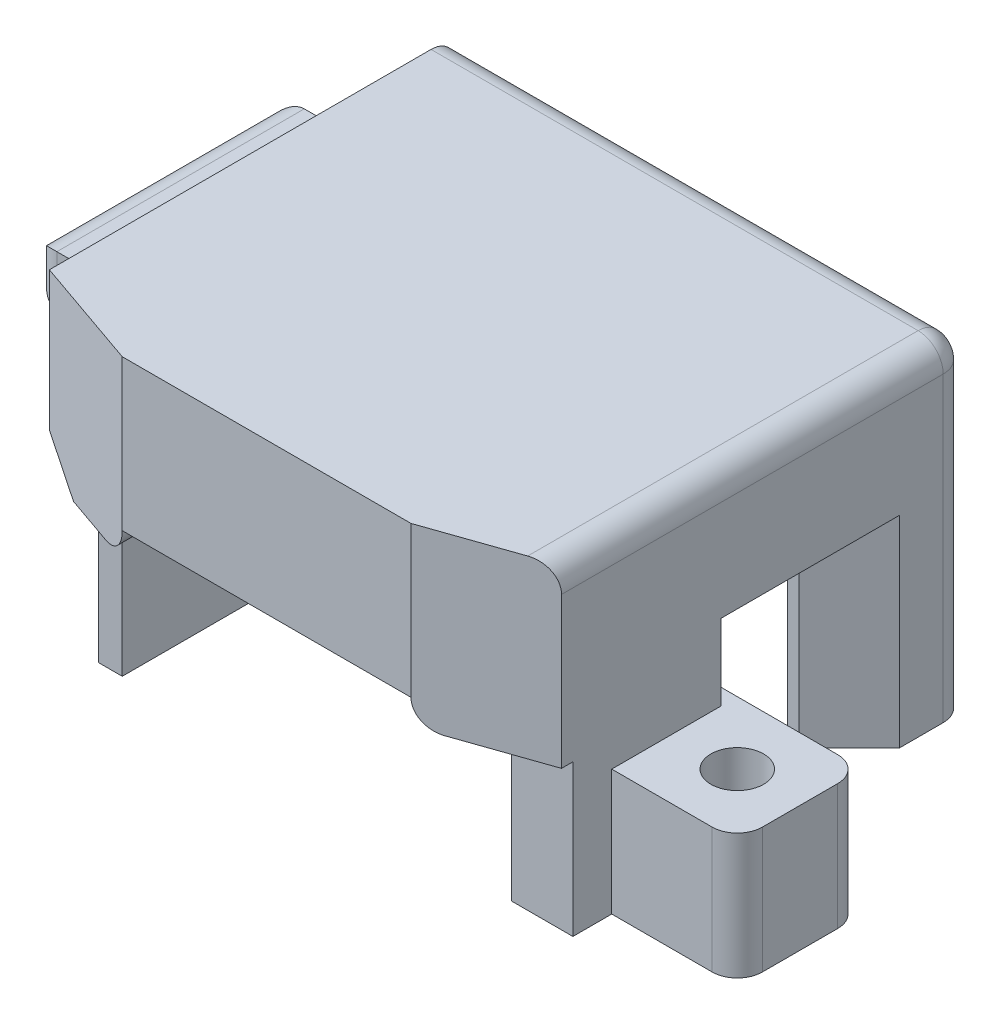
from build123d import *

# Parameters (mm, degrees)
SKETCH1_W            = 45.72
SKETCH1_H            = 43.18
BOSS_EXTRUDE1_DEPTH  = 31.75
SKETCH2_W            = 39.37
SKETCH2_H            = 36.83
CUT_EXTRUDE3_DEPTH   = 25.4
SKETCH3_W            = 45.72
SKETCH3_H            = 31.75
CUT_EXTRUDE5_DEPTH   = 3.175
BOSS_EXTRUDE4_DEPTH  = 38.1
SKETCH7_W            = 39.37
SKETCH7_H            = 25.151618727
BOSS_EXTRUDE5_DEPTH  = 36.83
SKETCH8_W            = 40.005
SKETCH8_H            = 69.85
BOSS_EXTRUDE6_DEPTH  = 6.35
SKETCH9_W            = 40.005
SKETCH9_H            = 69.85
BOSS_EXTRUDE7_DEPTH  = 6.35
CUT_EXTRUDE8_DEPTH   = 61.468
SKETCH13_W           = 58.42
SKETCH13_H           = 26.3525
BOSS_EXTRUDE8_DEPTH  = 16.002
CUT_EXTRUDE9_DEPTH   = 16.51
SKETCH15_W           = 37.994827887
SKETCH15_H           = 16.002
BOSS_EXTRUDE9_DEPTH  = 5.08
SKETCH16_W           = 58.42
SKETCH16_H           = 40.005
CUT_EXTRUDE11_DEPTH  = 38.1
SKETCH17_W           = 9.525
SKETCH17_H           = 12.7
BOSS_EXTRUDE10_DEPTH = 13.97
SKETCH18_W           = 9.525
SKETCH18_H           = 12.7
BOSS_EXTRUDE11_DEPTH = 13.97
SKETCH19_W           = 39.37
SKETCH19_H           = 3.81
BOSS_EXTRUDE14_DEPTH = 5.08
CUT_EXTRUDE12_DEPTH  = 3.81
BOSS_EXTRUDE22_DEPTH = 3.809999
BOSS_EXTRUDE23_START = -1e-06
BOSS_EXTRUDE23_DEPTH = 21.34162
BOSS_EXTRUDE24_DEPTH = 6.598381
SKETCH40_W           = 39.37
SKETCH40_H           = 36.83
BOSS_EXTRUDE25_DEPTH = 4.826
SKETCH42_W           = 37.994827887
SKETCH42_H           = 16.002
BOSS_EXTRUDE26_DEPTH = 3.302
SKETCH43_W           = 39.37
SKETCH43_H           = 13.582012484
CUT_EXTRUDE13_DEPTH  = 6.35
SKETCH45_W           = 39.37
SKETCH45_H           = 13.582012484
BOSS_EXTRUDE27_DEPTH = 19.05
CUT_EXTRUDE15_DEPTH  = 3.302
CUT_EXTRUDE16_DEPTH  = 3.302
SKETCH48_W           = 3.302
SKETCH48_H           = 36.576
CUT_EXTRUDE17_DEPTH  = 3.302
SKETCH49_W           = 3.302
SKETCH49_H           = 36.576
CUT_EXTRUDE18_DEPTH  = 3.302
SKETCH50_W           = 63.22676162
SKETCH50_H           = 45.986337428
CUT_EXTRUDE19_DEPTH  = 16.002
SKETCH51_W           = 54.973573954
SKETCH51_H           = 46.584394505
CUT_EXTRUDE20_DEPTH  = 18.796
SKETCH52_W           = 6.223
SKETCH52_H           = 20.055366997
SKETCH52_H_2         = 8.89
BOSS_EXTRUDE28_DEPTH = 15.3035
SKETCH53_W           = 12.7
SKETCH53_H           = 3.81
BOSS_EXTRUDE29_DEPTH = 10.16
SKETCH54_W           = 12.7
SKETCH54_H           = 3.81
BOSS_EXTRUDE30_DEPTH = 10.16
CUT_EXTRUDE21_DEPTH  = 12.7
CUT_EXTRUDE22_DEPTH  = 12.7
SKETCH60_R           = 2.667
CUT_EXTRUDE25_DEPTH  = 10.16
SKETCH62_W           = 29.21
SKETCH62_H           = 5.08
CUT_EXTRUDE27_DEPTH  = 2.54
SKETCH63_W           = 25.4
SKETCH63_H           = 38.1
CUT_EXTRUDE28_DEPTH  = 3.175
SKETCH64_W           = 12.102561389
SKETCH64_H           = 15.659817378
SKETCH64_W_2         = 11.935696887
SKETCH64_H_2         = 14.711913551
CUT_EXTRUDE29_DEPTH  = 3.81
SKETCH65_W           = 12.7
SKETCH65_H           = 12.7
SKETCH65_R           = 2.667
BOSS_EXTRUDE31_DEPTH = 12.7
SKETCH66_W           = 6.35
SKETCH66_H           = 13.97
CUT_EXTRUDE30_DEPTH  = 85.737175224
SKETCH68_W           = 3.81
SKETCH68_H           = 13.97
CUT_EXTRUDE31_DEPTH  = 29.718
CHAMFER1_SIZE        = 5.08
BOSS_EXTRUDE32_DEPTH = 12.7
FILLET8_R            = 2.54
FILLET9_R            = 2.54
FILLET13_R           = 2.54
FILLET14_R           = 2.54
FILLET1_R            = 2.54
FILLET2_R            = 2.54
FILLET17_R           = 2.54
CHAMFER2_SIZE        = 1.27


with BuildPart() as part:
    # Sketch1 → Boss-Extrude1 (new body)
    with BuildSketch(Plane(origin=(0, 0, 0), x_dir=(1, 0, 0), z_dir=(0, 1, 0))):
        Rectangle(SKETCH1_W, SKETCH1_H)
    extrude(amount=BOSS_EXTRUDE1_DEPTH)

    # Sketch2 → Cut-Extrude3 (cut)
    with BuildSketch(Plane(origin=(0, 31.75, 0), x_dir=(1, 0, 0), z_dir=(0, 1, 0))):
        Rectangle(SKETCH2_W, SKETCH2_H)
    extrude(amount=-CUT_EXTRUDE3_DEPTH, mode=Mode.SUBTRACT)

    # Sketch3 → Cut-Extrude5 (cut)
    with BuildSketch(Plane.XY.offset(21.59)):
        with Locations((0, 15.875)):
            Rectangle(SKETCH3_W, SKETCH3_H)
    extrude(amount=-CUT_EXTRUDE5_DEPTH, mode=Mode.SUBTRACT)

    # Sketch6 → Boss-Extrude4 (add)
    with BuildSketch(Plane(origin=(0, 31.75, 0), x_dir=(1, 0, 0), z_dir=(0, 1, 0))):
        Polygon((-22.86, -18.415), (-19.685, -18.415), (-19.685, 18.415), (19.685, 18.415), (19.685, -18.415), (22.86, -18.415), (22.86, 21.59), (-22.86, 21.59), align=None)
    extrude(amount=BOSS_EXTRUDE4_DEPTH)

    # Sketch7 → Boss-Extrude5 (add)
    with BuildSketch(Plane.XY.offset(-18.415)):
        with Locations((0, 57.274190637)):
            Rectangle(SKETCH7_W, SKETCH7_H)
    extrude(amount=BOSS_EXTRUDE5_DEPTH)

    # Sketch8 → Boss-Extrude6 (add)
    with BuildSketch(Plane(origin=(22.86, 0, 0), x_dir=(0, 0, -1), z_dir=(1, 0, 0))):
        with Locations((1.5875, 34.925)):
            Rectangle(SKETCH8_W, SKETCH8_H)
    extrude(amount=BOSS_EXTRUDE6_DEPTH)

    # Sketch9 → Boss-Extrude7 (add)
    with BuildSketch(Plane.ZY.offset(22.86)):
        with Locations((-1.5875, 34.925)):
            Rectangle(SKETCH9_W, SKETCH9_H)
    extrude(amount=BOSS_EXTRUDE7_DEPTH)

    # Sketch11 → Cut-Extrude8 (cut)
    with BuildSketch(Plane.ZY.offset(29.21)):
        Polygon((4.7625, 58.280393757), (-1.5875, 58.280393757), (-7.9375, 58.280393757), (-7.9375, 44.310393757), (4.7625, 44.310393757), align=None)
    extrude(amount=-CUT_EXTRUDE8_DEPTH, mode=Mode.SUBTRACT)

    # Sketch13 → Boss-Extrude8 (add)
    with BuildSketch(Plane(origin=(0, 69.85, 0), x_dir=(1, 0, 0), z_dir=(0, 1, 0))):
        with Locations((0, 8.41375)):
            Rectangle(SKETCH13_W, SKETCH13_H)
    extrude(amount=BOSS_EXTRUDE8_DEPTH)

    # Sketch14 → Cut-Extrude9 (cut)
    with BuildSketch(Plane(origin=(0, 0, -21.59), x_dir=(-1, 0, 0), z_dir=(0, 0, -1))):
        Polygon((10.16, 85.852), (0, 85.852), (-10.16, 85.852), (-10.16, 73.175571961), (-3.81, 73.175571961), (10.16, 73.175571961), align=None)
    extrude(amount=-CUT_EXTRUDE9_DEPTH, mode=Mode.SUBTRACT)

    # Sketch15 → Boss-Extrude9 (add)
    with BuildSketch(Plane.XY.offset(4.7625)):
        with Locations((0.097658191, 77.851)):
            Rectangle(SKETCH15_W, SKETCH15_H)
    extrude(amount=BOSS_EXTRUDE9_DEPTH)

    # Sketch16 → Cut-Extrude11 (cut)
    with BuildSketch(Plane.XZ):
        with Locations((0, -1.5875)):
            Rectangle(SKETCH16_W, SKETCH16_H)
    extrude(amount=-CUT_EXTRUDE11_DEPTH, mode=Mode.SUBTRACT)

    # Sketch17 → Boss-Extrude10 (add)
    with BuildSketch(Plane(origin=(0, 44.310393757, 0), x_dir=(1, 0, 0), z_dir=(0, 1, 0))):
        with Locations((24.4475, 1.5875)):
            Rectangle(SKETCH17_W, SKETCH17_H)
    extrude(amount=BOSS_EXTRUDE10_DEPTH)

    # Sketch18 → Boss-Extrude11 (add)
    with BuildSketch(Plane(origin=(0, 44.310393757, 0), x_dir=(1, 0, 0), z_dir=(0, 1, 0))):
        with Locations((-24.4475, 1.5875)):
            Rectangle(SKETCH18_W, SKETCH18_H)
    extrude(amount=BOSS_EXTRUDE11_DEPTH)

    # Sketch19 → Boss-Extrude14 (add)
    with BuildSketch(Plane.XY.offset(18.415)):
        with Locations((0, 46.603381273)):
            Rectangle(SKETCH19_W, SKETCH19_H)
    extrude(amount=BOSS_EXTRUDE14_DEPTH)

    # Sketch21 → Cut-Extrude12 (cut)
    with BuildSketch(Plane.XZ.offset(-44.698381273)):
        Polygon((-19.685, 18.415), (-19.685, 23.495), (-14.605, 23.495), align=None)
        Polygon((19.685, 18.415), (19.685, 23.495), (14.605, 23.495), align=None)
    extrude(amount=-CUT_EXTRUDE12_DEPTH, mode=Mode.SUBTRACT)

    # Sketch36 → Boss-Extrude22 (add)
    with BuildSketch(Plane.XZ.offset(-44.698381273)):
        Polygon((-14.605, 23.495), (-29.21, 18.415), (-14.605, 18.415), align=None)
        Polygon((14.605, 23.495), (29.21, 18.415), (14.605, 18.415), align=None)
    extrude(amount=-BOSS_EXTRUDE22_DEPTH)

    # Sketch37 → Boss-Extrude23 (add)
    with BuildSketch(Plane(origin=(0, 48.508381273, 0), x_dir=(1, 0, 0), z_dir=(0, 1, 0)).offset(BOSS_EXTRUDE23_START)):
        Polygon((-29.21, -18.415), (-14.605, -23.495), (14.605, -23.495), (29.21, -18.415), align=None)
    extrude(amount=BOSS_EXTRUDE23_DEPTH)

    # Sketch39 → Boss-Extrude24 (add)
    with BuildSketch(Plane.XZ.offset(-44.698381273)):
        Polygon((-29.21, 18.415), (-14.605, 23.495), (14.605, 23.495), (29.21, 18.415), align=None)
    extrude(amount=BOSS_EXTRUDE24_DEPTH)

    # Sketch40 → Boss-Extrude25 (add)
    with BuildSketch(Plane(origin=(0, 38.1, 0), x_dir=(-1, 0, 0), z_dir=(0, -1, 0))):
        Polygon((29.21, 21.59), (-29.21, 21.59), (-29.21, -18.415), (-14.605, -23.495), (14.605, -23.495), (29.21, -18.415), align=None)
        Rectangle(SKETCH40_W, SKETCH40_H, mode=Mode.SUBTRACT)
    extrude(amount=BOSS_EXTRUDE25_DEPTH)

    # Sketch42 → Boss-Extrude26 (add)
    with BuildSketch(Plane.XY.offset(9.8425)):
        with Locations((0.097658191, 77.851)):
            Rectangle(SKETCH42_W, SKETCH42_H)
    extrude(amount=BOSS_EXTRUDE26_DEPTH)

    # Sketch43 → Cut-Extrude13 (cut)
    with BuildSketch(Plane(origin=(0, 0, 4.7625), x_dir=(-1, 0, 0), z_dir=(0, 0, -1))):
        with Locations((0, 51.489387515)):
            Rectangle(SKETCH43_W, SKETCH43_H)
    extrude(amount=-CUT_EXTRUDE13_DEPTH, mode=Mode.SUBTRACT)

    # Sketch45 → Boss-Extrude27 (add)
    with BuildSketch(Plane.XY.offset(-7.9375)):
        with Locations((0, 51.489387515)):
            Rectangle(SKETCH45_W, SKETCH45_H)
    extrude(amount=BOSS_EXTRUDE27_DEPTH)

    # Sketch46 → Cut-Extrude15 (cut)
    with BuildSketch(Plane.ZY.offset(29.21)):
        Polygon((-21.59, 85.852), (-21.59, 33.274), (18.415, 33.274), (18.415, 69.85), (13.1445, 69.85), (13.1445, 85.852), align=None)
    extrude(amount=-CUT_EXTRUDE15_DEPTH, mode=Mode.SUBTRACT)

    # Sketch47 → Cut-Extrude16 (cut)
    with BuildSketch(Plane(origin=(29.21, 0, 0), x_dir=(0, 0, -1), z_dir=(1, 0, 0))):
        Polygon((-4.7625, 85.852), (-4.7625, 69.85), (-18.415, 69.85), (-18.415, 33.274), (21.59, 33.274), (21.59, 85.852), align=None)
    extrude(amount=-CUT_EXTRUDE16_DEPTH, mode=Mode.SUBTRACT)

    # Sketch48 → Cut-Extrude17 (cut)
    with BuildSketch(Plane(origin=(0, 0, 18.415), x_dir=(-1, 0, 0), z_dir=(0, 0, -1))):
        with Locations((-27.559, 51.562)):
            Rectangle(SKETCH48_W, SKETCH48_H)
    extrude(amount=-CUT_EXTRUDE17_DEPTH, mode=Mode.SUBTRACT)

    # Sketch49 → Cut-Extrude18 (cut)
    with BuildSketch(Plane(origin=(0, 0, 18.415), x_dir=(-1, 0, 0), z_dir=(0, 0, -1))):
        with Locations((27.559, 51.562)):
            Rectangle(SKETCH49_W, SKETCH49_H)
    extrude(amount=-CUT_EXTRUDE18_DEPTH, mode=Mode.SUBTRACT)

    # Sketch50 → Cut-Extrude19 (cut)
    with BuildSketch(Plane(origin=(0, 85.852, 0), x_dir=(1, 0, 0), z_dir=(0, 1, 0))):
        with Locations((5.70538081, -1.403168714)):
            Rectangle(SKETCH50_W, SKETCH50_H)
    extrude(amount=-CUT_EXTRUDE19_DEPTH, mode=Mode.SUBTRACT)

    # Sketch51 → Cut-Extrude20 (cut)
    with BuildSketch(Plane(origin=(0, 69.85, 0), x_dir=(1, 0, 0), z_dir=(0, 1, 0))):
        with Locations((1.578786977, -1.702197253)):
            Rectangle(SKETCH51_W, SKETCH51_H)
    extrude(amount=-CUT_EXTRUDE20_DEPTH, mode=Mode.SUBTRACT)

    # Sketch52 → Boss-Extrude28 (add)
    with BuildSketch(Plane(origin=(0, 33.274, 0), x_dir=(-1, 0, 0), z_dir=(0, -1, 0))):
        with Locations((-22.7965, -8.387316502)):
            Rectangle(SKETCH52_W, SKETCH52_H)
        with Locations((-22.7965, 13.97)):
            Rectangle(SKETCH52_W, SKETCH52_H_2)
        Polygon((-25.908, 18.415), (-19.685, 18.415), (19.685, 18.415), (19.685, 21.59), (-25.908, 21.59), align=None)
        Polygon((19.685, 21.59), (19.685, 18.415), (19.685, -18.415), (25.908, -18.415), (25.908, 21.59), align=None)
    extrude(amount=BOSS_EXTRUDE28_DEPTH)

    # Sketch53 → Boss-Extrude29 (add)
    with BuildSketch(Plane(origin=(25.908, 0, 0), x_dir=(0, 0, -1), z_dir=(1, 0, 0))):
        with Locations((-12.065, 19.8755)):
            Rectangle(SKETCH53_W, SKETCH53_H)
    extrude(amount=BOSS_EXTRUDE29_DEPTH)

    # Sketch54 → Boss-Extrude30 (add)
    with BuildSketch(Plane.ZY.offset(25.908)):
        with Locations((12.065, 19.8755)):
            Rectangle(SKETCH54_W, SKETCH54_H)
    extrude(amount=BOSS_EXTRUDE30_DEPTH)

    # Sketch55 → Cut-Extrude21 (cut)
    with BuildSketch(Plane(origin=(0, 21.7805, 0), x_dir=(1, 0, 0), z_dir=(0, 1, 0))):
        with BuildLine():
            ThreePointArc((36.068, -13.335), (34.418983891, -16.765983891), (30.988, -18.415))
            Line((30.988, -18.415), (36.068, -18.415))
            Line((36.068, -18.415), (36.068, -13.335))
        make_face()
    extrude(amount=-CUT_EXTRUDE21_DEPTH, mode=Mode.SUBTRACT)

    # Sketch56 → Cut-Extrude22 (cut)
    with BuildSketch(Plane(origin=(0, 21.7805, 0), x_dir=(1, 0, 0), z_dir=(0, 1, 0))):
        with BuildLine():
            Line((-36.068, -18.415), (-30.988, -18.415))
            ThreePointArc((-30.988, -18.415), (-34.418983891, -16.765983891), (-36.068, -13.335))
            Line((-36.068, -13.335), (-36.068, -18.415))
        make_face()
    extrude(amount=-CUT_EXTRUDE22_DEPTH, mode=Mode.SUBTRACT)

    # Sketch60 → Cut-Extrude25 (cut)
    with BuildSketch(Plane(origin=(0, 21.7805, 0), x_dir=(1, 0, 0), z_dir=(0, 1, 0))):
        with Locations(Location((30.353, -12.7, 0), (0, 0, 270))):
            Circle(SKETCH60_R)
        with Locations(Location((-30.353, -12.7, 0), (0, 0, 270))):
            Circle(SKETCH60_R)
    extrude(amount=-CUT_EXTRUDE25_DEPTH, mode=Mode.SUBTRACT)

    # Sketch62 → Cut-Extrude27 (cut)
    with BuildSketch(Plane.XZ.offset(-33.274)):
        with Locations((0, 20.955)):
            Rectangle(SKETCH62_W, SKETCH62_H)
    extrude(amount=-CUT_EXTRUDE27_DEPTH, mode=Mode.SUBTRACT)

    # Sketch63 → Cut-Extrude28 (cut)
    with BuildSketch(Plane.XY.offset(-18.415)):
        with Locations((0, 17.9705)):
            Rectangle(SKETCH63_W, SKETCH63_H)
    extrude(amount=-CUT_EXTRUDE28_DEPTH, mode=Mode.SUBTRACT)

    # Sketch64 → Cut-Extrude29 (cut)
    with BuildSketch(Plane.XZ.offset(-17.9705)):
        with Locations((-31.959280695, 13.544908689)):
            Rectangle(SKETCH64_W, SKETCH64_H)
        with Locations((31.875848444, 13.070956776)):
            Rectangle(SKETCH64_W_2, SKETCH64_H_2)
    extrude(amount=-CUT_EXTRUDE29_DEPTH, mode=Mode.SUBTRACT)

    # Sketch65 → Boss-Extrude31 (add)
    # profile 1 of 2: a face of its own
    with BuildSketch(Plane.XZ.offset(-17.9705)):
        with Locations((32.258, 8.133521739)):
            Rectangle(SKETCH65_W, SKETCH65_H)
        with Locations(Location((32.258, 8.133521739, 0), (0, 0, 270))):
            Circle(SKETCH65_R, mode=Mode.SUBTRACT)
    # profile 2 of 2: a face of its own
    with BuildSketch(Plane.XZ.offset(-17.9705)):
        with Locations((-19.558, -27.94)):
            Rectangle(SKETCH65_W, SKETCH65_H)
        with Locations(Location((-19.558, -27.94, 0), (0, 0, 270))):
            Circle(SKETCH65_R, mode=Mode.SUBTRACT)
    extrude(amount=-BOSS_EXTRUDE31_DEPTH)

    # Sketch66 → Cut-Extrude30 (cut, through all)
    with BuildSketch(Plane(origin=(-19.685, 0, 0), x_dir=(0, 0, -1), z_dir=(1, 0, 0))):
        with Locations((8.128, 24.9555)):
            Rectangle(SKETCH66_W, SKETCH66_H)
    extrude(amount=-CUT_EXTRUDE30_DEPTH, mode=Mode.SUBTRACT)

    # Sketch68 → Cut-Extrude31 (cut)
    with BuildSketch(Plane.XY.offset(18.415)):
        with Locations((-24.003, 24.9555)):
            Rectangle(SKETCH68_W, SKETCH68_H)
    extrude(amount=-CUT_EXTRUDE31_DEPTH, mode=Mode.SUBTRACT)

    # Chamfer1
    chamfer1_edges = [part.edges().sort_by_distance(p)[0] for p in [
        (25.908, 33.274, -5.582683498),
        (25.908, 25.62225, -1.640366997),
        (25.908, 25.62225, -9.525),
        (-25.908, 31.9405, 3.556),
    ]]
    chamfer(chamfer1_edges, length=CHAMFER1_SIZE)

    # Sketch67 → Boss-Extrude32 (add)
    with BuildSketch(Plane.ZY.offset(25.908)):
        Polygon((-11.303, 17.9705), (-11.303, 37.0205), (8.646633003, 37.0205), (8.646633003, 42.1005), (-9.398, 42.1005), (-16.383, 42.1005), (-16.383, 17.9705), align=None)
    extrude(amount=BOSS_EXTRUDE32_DEPTH)

    # Fillet8
    fillet8_edges = [part.edges().sort_by_distance(p)[0] for p in [
        (14.605, 33.274, 20.955),
    ]]
    fillet(fillet8_edges, radius=FILLET8_R - 0.0001)  # a hair under: the kernel refuses the full size

    # Fillet9
    fillet9_edges = [part.edges().sort_by_distance(p)[0] for p in [
        (-14.605, 33.274, 20.955),
    ]]
    fillet(fillet9_edges, radius=FILLET9_R - 0.0001)  # a hair under: the kernel refuses the full size

    # Fillet13
    fillet13_edges = [part.edges().sort_by_distance(p)[0] for p in [
        (-12.7, 27.4955, -21.59),
        (12.7, 27.4955, -21.59),
        (0, 37.0205, -21.59),
    ]]
    fillet(fillet13_edges, radius=FILLET13_R)

    # Fillet14
    fillet14_edges = [part.edges().sort_by_distance(p)[0] for p in [
        (-13.208, 24.3205, -34.29),
        (-25.908, 24.3205, -34.29),
        (38.608, 24.3205, 14.483521739),
        (38.608, 24.3205, 1.783521739),
    ]]
    fillet(fillet14_edges, radius=FILLET14_R)

    # Fillet1
    fillet1_edges = [part.edges().sort_by_distance(p)[0] for p in [
        (25.908, 51.054, -1.01323913),
    ]]
    fillet(fillet1_edges, radius=FILLET1_R)

    # Fillet2
    fillet2_edges = [part.edges().sort_by_distance(p)[0] for p in [
        (25.908, 33.24225, -21.59),
        (-1.27, 51.054, -21.59),
        (25.164051224, 50.310051224, -21.59),
    ]]
    fillet(fillet2_edges, radius=FILLET2_R)

    # Fillet17
    fillet17_edges = [part.edges().sort_by_distance(p)[0] for p in [
        (-38.608, 39.5605, 8.646633003),
        (-38.608, 37.0205, -1.328183498),
        (-38.608, 42.1005, -3.868183498),
        (-38.608, 30.0355, -16.383),
        (-38.608, 27.4955, -11.303),
    ]]
    fillet(fillet17_edges, radius=FILLET17_R - 0.0001)  # a hair under: the kernel refuses the full size

    # Chamfer2
    chamfer2_edges = [part.edges().sort_by_distance(p)[0] for p in [
        (-22.098, 25.5905, -4.953),
    ]]
    chamfer(chamfer2_edges, length=CHAMFER2_SIZE)


solid = part.part
